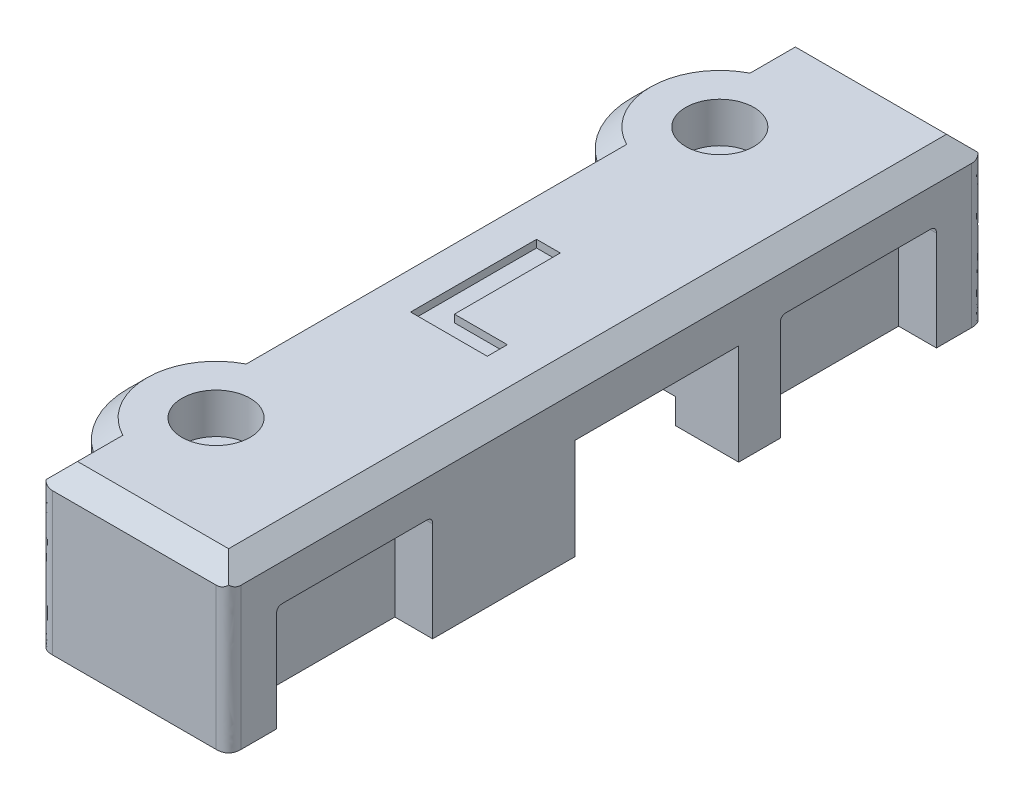
from build123d import *

# Parameters (mm, degrees)
SKETCH1_W               = 15
SKETCH1_H               = 60
SKETCH1_R               = 1.65
BOSS_EXTRUDE1_DEPTH     = 12.8
CUT_EXTRUDE3_DEPTH      = 34.467745667
CUT_EXTRUDE3_DEPTH_BACK = 8
SKETCH5_W               = 13
SKETCH5_H               = 13
SKETCH6_R               = 1.45
CUT_EXTRUDE4_DEPTH      = 3
SKETCH8_R               = 2.7
CUT_EXTRUDE6_DEPTH      = 3.2
SKETCH9_W               = 4
SKETCH9_H               = 19.5
CUT_EXTRUDE7_DEPTH      = 2
SKETCH10_W              = 12.4
SKETCH10_H              = 8.4
CUT_EXTRUDE8_DEPTH      = 3
CUT_EXTRUDE9_DEPTH      = 0.6
FILLET1_SIZE            = 0.5
BOSS_EXTRUDE2_DEPTH     = 12.8
CHAMFER2_SIZE           = 1.5
FILLET3_SIZE            = 1
CHAMFER3_SIZE           = 0.6


with BuildPart() as part:
    # Sketch1 → Boss-Extrude1 (new body)
    with BuildSketch(Plane(origin=(0, 0, 0), x_dir=(1, 0, 0), z_dir=(0, 1, 0))):
        Rectangle(SKETCH1_W, SKETCH1_H)
        with Locations(Location((-3.5, 20, 0), (0, 0, 270))):
            Circle(SKETCH1_R, mode=Mode.SUBTRACT)
        with Locations(Location((-3.5, -20, 0), (0, 0, 270))):
            Circle(SKETCH1_R, mode=Mode.SUBTRACT)
    extrude(amount=BOSS_EXTRUDE1_DEPTH)

    # Sketch5 → Cut-Extrude3 (cut, two sides: drawn at the far end of the back side and taken through both)
    with BuildSketch(Plane.XZ.offset(-CUT_EXTRUDE3_DEPTH_BACK)):
        with Locations((1, -4)):
            Rectangle(SKETCH5_W, SKETCH5_H)
    extrude(amount=CUT_EXTRUDE3_DEPTH + CUT_EXTRUDE3_DEPTH_BACK, mode=Mode.SUBTRACT)

    # Sketch6 → Cut-Extrude4 (cut)
    with BuildSketch(Plane.XZ.offset(-8)):
        with Locations(Location((2.5, -0.75, 0), (0, 0, 270))):
            Circle(SKETCH6_R)
        with Locations(Location((2.5, -7.25, 0), (0, 0, 90))):
            Circle(SKETCH6_R)
    extrude(amount=-CUT_EXTRUDE4_DEPTH, mode=Mode.SUBTRACT)

    # Sketch8 → Cut-Extrude6 (cut)
    with BuildSketch(Plane(origin=(0, 12.8, 0), x_dir=(1, 0, 0), z_dir=(0, 1, 0))):
        with Locations(Location((-3.5, 20, 0), (0, 0, 270))):
            Circle(SKETCH8_R)
        with Locations(Location((-3.5, -20, 0), (0, 0, 270))):
            Circle(SKETCH8_R)
    extrude(amount=-CUT_EXTRUDE6_DEPTH, mode=Mode.SUBTRACT)

    # Sketch9 → Cut-Extrude7 (cut)
    with BuildSketch(Plane.XZ):
        with Locations((0.5, -20.25)):
            Rectangle(SKETCH9_W, SKETCH9_H)
    extrude(amount=-CUT_EXTRUDE7_DEPTH, mode=Mode.SUBTRACT)

    # Sketch10 → Cut-Extrude8 (cut)
    with BuildSketch(Plane(origin=(7.5, 0, 0), x_dir=(0, 0, -1), z_dir=(1, 0, 0))):
        with Locations((-20, 4.2)):
            Rectangle(SKETCH10_W, SKETCH10_H)
        with Locations((20, 4.2)):
            Rectangle(SKETCH10_W, SKETCH10_H)
    extrude(amount=-CUT_EXTRUDE8_DEPTH, mode=Mode.SUBTRACT)

    # Sketch11 → Cut-Extrude9 (cut)
    with BuildSketch(Plane(origin=(0, 12.8, 0), x_dir=(1, 0, 0), z_dir=(0, 1, 0))):
        Polygon((-3.050724638, -5), (-3.050724638, 5), (-1.166666667, 5), (-1.166666667, -3.405797101), (3.036231884, -3.405797101), (3.036231884, -5), align=None)
    extrude(amount=-CUT_EXTRUDE9_DEPTH, mode=Mode.SUBTRACT)

    # Fillet1
    # a fillet whose section is not a circle: 0.5 mm, written as the material it adds along each edge
    with BuildSketch(Plane(origin=(7.5, 8.4, 26.2), x_dir=(0, 0, -1), z_dir=(-1, 0, 0)), Plane(origin=(7.5, 8.4, 13.8), x_dir=(0, -1, 0), z_dir=(-1, 0, 0)), Plane(origin=(7.5, 8.4, -13.8), x_dir=(0, 0, -1), z_dir=(-1, 0, 0)), Plane(origin=(7.5, 8.4, -26.2), x_dir=(0, -1, 0), z_dir=(-1, 0, 0))) as fillet1_piece_1:
        with BuildLine():
            Bezier((FILLET1_SIZE, 0), (0, 0), (0, FILLET1_SIZE), weights=[1, 1, 1])
            Line((0, FILLET1_SIZE), (0, 0))
            Line((0, 0), (FILLET1_SIZE, 0))
        make_face()
    extrude(amount=4.25)

    # Sketch12 → Boss-Extrude2 (add)
    with BuildSketch(Plane(origin=(0, 0, 0), x_dir=(1, 0, 0), z_dir=(0, 1, 0))):
        with BuildLine():
            Line((-7.5, 25.744562647), (-7.5, 14.255437353))
            ThreePointArc((-7.5, 14.255437353), (-10.5, 20), (-7.5, 25.744562647))
        make_face()
        with BuildLine():
            Line((-7.5, -25.744562647), (-7.5, -14.255437353))
            ThreePointArc((-7.5, -14.255437353), (-10.5, -20), (-7.5, -25.744562647))
        make_face()
    extrude(amount=BOSS_EXTRUDE2_DEPTH)

    # Chamfer2
    chamfer2_edges = [part.edges().sort_by_distance(p)[0] for p in [
        (7.5, 12.8, 0),
        (-7.5, 12.8, 0),
        (0, 12.8, -30),
        (-7.5, 12.8, 27.872281323),
        (-10.5, 12.8, -20),
        (-10.5, 12.8, 20),
        (-7.5, 12.8, -27.872281323),
        (0, 12.8, 30),
    ]]
    chamfer(chamfer2_edges, length=CHAMFER2_SIZE)

    # Fillet3
    # a fillet whose section is not a circle: 1 mm, written as the material it takes off along each edge
    with BuildSketch(Plane(origin=(-7.5, -2.5, -30), x_dir=(1, 0, 0), z_dir=(0, 1, 0)), Plane(origin=(7.5, -2.5, -30), x_dir=(0, 0, 1), z_dir=(0, 1, 0))) as fillet3_piece_1:
        with BuildLine():
            Bezier((FILLET3_SIZE, 0), (0, 0), (0, -FILLET3_SIZE), weights=[1, 1, 1])
            Line((0, -FILLET3_SIZE), (0, 0))
            Line((0, 0), (FILLET3_SIZE, 0))
        make_face()
    extrude(amount=16.3, mode=Mode.SUBTRACT)
    with BuildSketch(Plane(origin=(7.5, -2.5, 30), x_dir=(0, 0, -1), z_dir=(0, 1, 0)), Plane(origin=(-7.5, -2.5, 30), x_dir=(1, 0, 0), z_dir=(0, 1, 0))) as fillet3_piece_2:
        with BuildLine():
            Bezier((FILLET3_SIZE, 0), (0, 0), (0, FILLET3_SIZE), weights=[1, 1, 1])
            Line((0, FILLET3_SIZE), (0, 0))
            Line((0, 0), (FILLET3_SIZE, 0))
        make_face()
    extrude(amount=16.3, mode=Mode.SUBTRACT)

    # Chamfer3
    chamfer3_edges = [part.edges().sort_by_distance(p)[0] for p in [
        (2.5, 8, 0.7),
        (2.5, 8, -8.7),
    ]]
    chamfer(chamfer3_edges, length=CHAMFER3_SIZE)


solid = part.part
